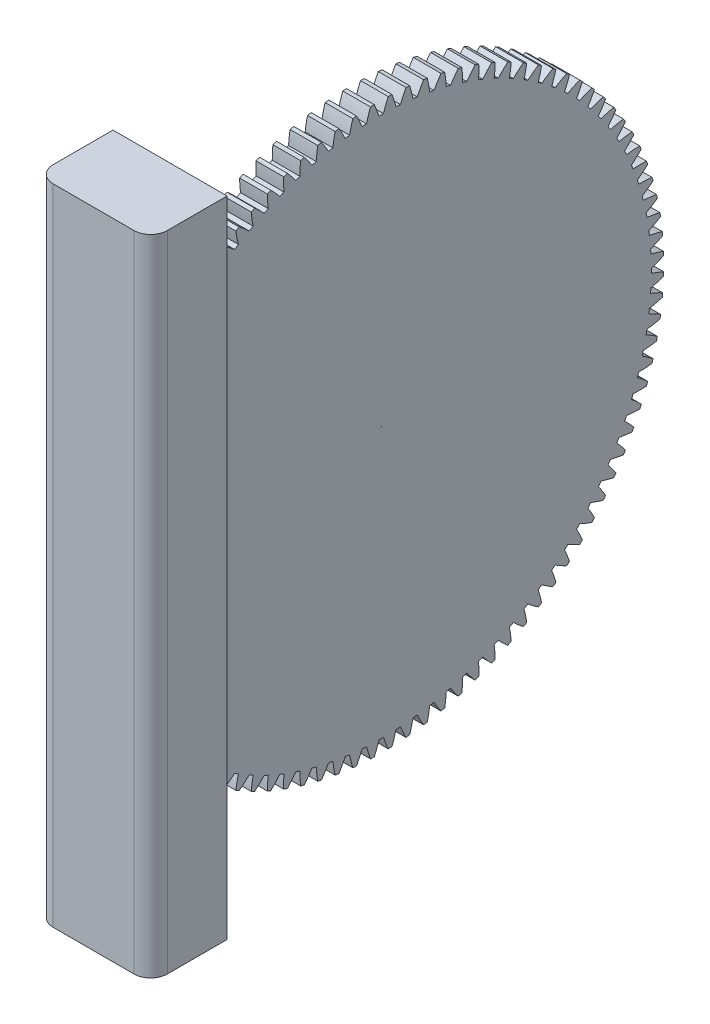
from build123d import *

# Parameters (mm, degrees)
BASPROSKE_W     = 10
BASPROSKE_H     = 102
TOOTHCUT_DEPTH  = 145.595988879
TEETHCUTS_COUNT = 100
TEETHCUTS_ANGLE = 356.4
BORSKE_R        = 0.1
BORE_DEPTH      = 50.0000508
SKETCH_1_W      = 41.2
SKETCH_1_H      = 232.470252916
EXTRUDE_1_DEPTH = 27.6
OTHER_START     = -116.14671818
OTHER_1_DEPTH   = 232.470252916


# Read off the part's stored shape, not the designer's step: Полость1
with BuildPart() as part:
    # BasProSke → Base-Revolve (revolve)
    with BuildSketch(Plane(origin=(0, 0, 0), x_dir=(1, 0, 0), z_dir=(0, 1, 0)), mode=Mode.PRIVATE) as base_revolve_sk:
        with Locations((5, 51)):
            Rectangle(BASPROSKE_W, BASPROSKE_H)
    revolve(base_revolve_sk.sketch.rotate(Axis((-10, 0, 0), (1, 0, 0)), 180), axis=Axis((-10, 0, 0), (1, 0, 0)))

    # TooCutSke → ToothCut (cut, through all)
    with BuildSketch(Plane(origin=(0, 0, 0), x_dir=(0, 0, -1), z_dir=(1, 0, 0))):
        with BuildLine():
            ThreePointArc((0.814317866, 97.495599323), (0, 97.499), (-0.814317866, 97.495599323))
            ThreePointArc((-0.814317866, 97.495599323), (-1.605159394, 99.770655719), (-2.531497118, 101.993988879))
            ThreePointArc((-2.531497118, 101.993988879), (0, 102.0254), (2.531497118, 101.993988879))
            ThreePointArc((2.531497118, 101.993988879), (1.605159394, 99.770655719), (0.814317866, 97.495599323))
        make_face()
    toothcut = extrude(amount=TOOTHCUT_DEPTH, mode=Mode.SUBTRACT)

    # TeethCuts: ToothCut ×100 about axis
    teethcuts_axis = Axis((-10, 0, 0), (1, 0, 0))
    for i in range(1, TEETHCUTS_COUNT):
        add(toothcut.rotate(teethcuts_axis, i * TEETHCUTS_ANGLE / (TEETHCUTS_COUNT - 1)), mode=Mode.SUBTRACT)

    # BorSke → Bore (cut, symmetric)
    with BuildSketch(Plane(origin=(0, 0, 0), x_dir=(0, 0, -1), z_dir=(1, 0, 0))):
        with Locations(Location((0, 0, 0), (0, 0, 180))):
            Circle(BORSKE_R)
    extrude(amount=BORE_DEPTH, both=True, mode=Mode.SUBTRACT)

    # Эскиз1 → Бобышка-Вытянуть1 (add)
    with BuildSketch(Plane(origin=(0, 0, 72), x_dir=(-1, 0, 0), z_dir=(0, 0, -1))):
        with Locations((-5.75, 0.088408278)):
            Rectangle(SKETCH_1_W, SKETCH_1_H)
    extrude(amount=-EXTRUDE_1_DEPTH)

    # Полость1 outline → Полость1 (cut)
    with BuildSketch(Plane(origin=(0, 0, 0), x_dir=(1, 0, 0), z_dir=(0, 1, 0)).offset(OTHER_START)):
        with BuildLine():
            Line((26.35, -99.6), (26.35, -93.6))
            ThreePointArc((26.35, -93.6), (24.592640687, -97.842640687), (20.35, -99.6))
            Line((20.35, -99.6), (10, -99.6))
            Line((10, -99.6), (0, -99.6))
            Line((0, -99.6), (-8.85, -99.6))
            ThreePointArc((-8.85, -99.6), (-13.092640687, -97.842640687), (-14.85, -93.6))
            Line((-14.85, -93.6), (-14.85, -99.6))
            Line((-14.85, -99.6), (-16, -99.600000002))
            Line((-16, -99.600000002), (-16, -103))
            Line((-16, -103), (28, -103))
            Line((28, -103), (28, -99.600000003))
            Line((28, -99.600000003), (26.35, -99.6))
        make_face()
    extrude(amount=OTHER_1_DEPTH, mode=Mode.SUBTRACT)


solid = part.part
